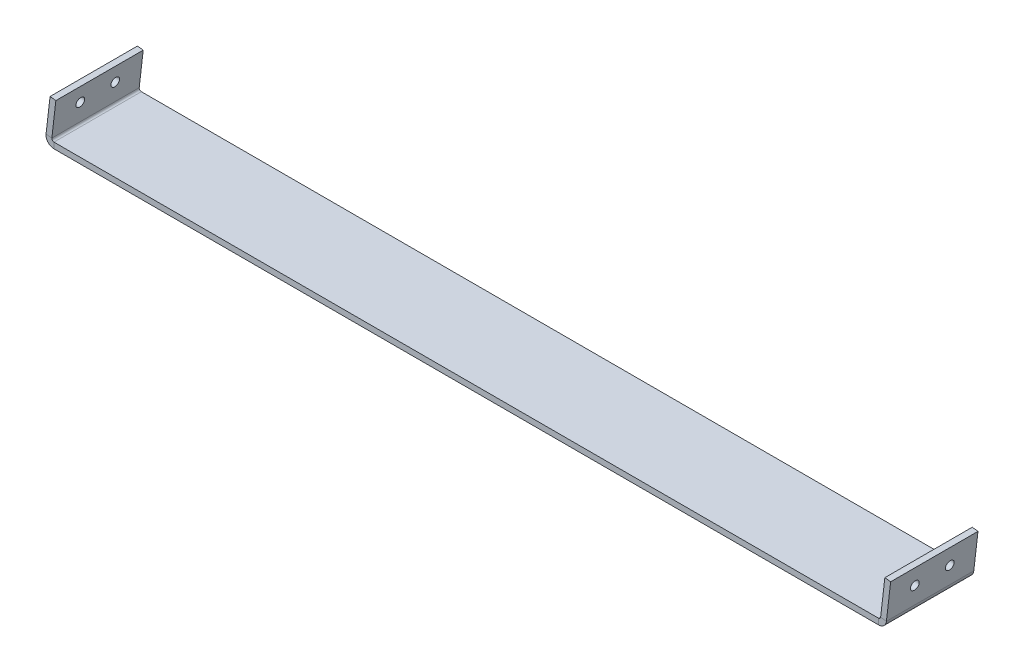
from build123d import *

# Parameters (mm, degrees)
SKETCH1_W                    = 284.5815
SKETCH1_H                    = 30
BASE_FLANGE1_DEPTH           = 2
EDGE_FLANGE1_STRIP_CUT_DEPTH = 30
EDGE_FLANGE1_DEPTH           = 30
EDGE_FLANGE2_STRIP_CUT_DEPTH = 30
EDGE_FLANGE2_DEPTH           = 30
SKETCH10_R                   = 1.5
MOUNTING_HOLES_DEPTH         = 2
SKETCH11_R                   = 1.5
CUT_EXTRUDE2_DEPTH           = 2


# Sheet-metal steps are written as plain solids
with BuildPart() as part:
    # Sketch1 → Base-Flange1 (new body)
    with BuildSketch(Plane(origin=(0, 0, 0), x_dir=(1, 0, 0), z_dir=(0, 1, 0))):
        with Locations((142.29075, -15)):
            Rectangle(SKETCH1_W, SKETCH1_H)
    extrude(amount=-BASE_FLANGE1_DEPTH)

    # Edge-Flange1 strip (across the edge) → Edge-Flange1 strip cut (cut)
    with BuildSketch(Plane(origin=(0, 0, 0), x_dir=(0.9933652782994915, -0.1150018428938158, 0), z_dir=(0, 0, 1))):
        Polygon((-9.511321415, -3.11448322), (1.051314043, -1.891647502), (0.821310357, 0.095083054), (-9.741325101, -1.127752664), align=None)
    extrude(amount=EDGE_FLANGE1_STRIP_CUT_DEPTH, mode=Mode.SUBTRACT)

    # Edge-Flange1 section (across the edge) → Edge-Flange1 (add)
    with BuildSketch(Plane(origin=(0, 0, 0), x_dir=(0.9933652782994915, -0.1150018428938158, 0), z_dir=(0, 0, 1))):
        with BuildLine():
            Line((-2, 0.826795918), (-2, 12.755102041))
            Line((-2, 12.755102041), (0, 12.755102041))
            Line((0, 12.755102041), (0, 0.826795918))
            ThreePointArc((0, 0.826795918), (0.246609229, 0.276806278), (0.821310357, 0.095083054))
            Line((0.821310357, 0.095083054), (1.051314043, -1.891647502))
            ThreePointArc((1.051314043, -1.891647502), (-1.083802855, -1.216513409), (-2, 0.826795918))
        make_face()
    extrude(amount=EDGE_FLANGE1_DEPTH)

    # Edge-Flange2 strip (across the edge) → Edge-Flange2 strip cut (cut)
    with BuildSketch(Plane(origin=(284.5815, 0, 30), x_dir=(-0.9933652782994906, 0.11500184289382274, 0), z_dir=(0, 0, -1))):
        Polygon((-8.988461998, -0.972764326), (0.421885957, -2.062199784), (0.651889643, -0.075469228), (-8.758458312, 1.013966231), align=None)
    extrude(amount=EDGE_FLANGE2_STRIP_CUT_DEPTH, mode=Mode.SUBTRACT)

    # Edge-Flange2 section (across the edge) → Edge-Flange2 (add)
    with BuildSketch(Plane(origin=(284.5815, 0, 30), x_dir=(-0.9933652782994906, 0.11500184289382274, 0), z_dir=(0, 0, -1))):
        with BuildLine():
            Line((-2, 0.656243636), (-2, 13.218181818))
            Line((-2, 13.218181818), (0, 13.218181818))
            Line((0, 13.218181818), (0, 0.656243636))
            ThreePointArc((0, 0.656243636), (0.186610359, 0.166252866), (0.651889643, -0.075469228))
            Line((0.651889643, -0.075469228), (0.421885957, -2.062199784))
            ThreePointArc((0.421885957, -2.062199784), (-1.306709327, -1.164159219), (-2, 0.656243636))
        make_face()
    extrude(amount=EDGE_FLANGE2_DEPTH)

    # Sketch10 → Mounting Holes (cut)
    with BuildSketch(Plane(origin=(-1.986730557, 0.230003686, 0), x_dir=(0, 0, 1), z_dir=(-0.9933652782994914, 0.11500184289381583, 0))):
        with Locations(Location((9, 7.408352498, 0), (0, 0, 270))):
            Circle(SKETCH10_R)
        with Locations(Location((21, 7.408352498, 0), (0, 0, 270))):
            Circle(SKETCH10_R)
    extrude(amount=-MOUNTING_HOLES_DEPTH, mode=Mode.SUBTRACT)

    # Sketch11 → Cut-Extrude2 (cut)
    with BuildSketch(Plane(origin=(282.804519594, -32.740263469, 0), x_dir=(0, 0, -1), z_dir=(0.9933652782994908, -0.11500184289382205, 0))):
        with Locations(Location((-21, 39.945578772, 0), (0, 0, 90))):
            Circle(SKETCH11_R)
        with Locations(Location((-9, 39.945578772, 0), (0, 0, 90))):
            Circle(SKETCH11_R)
    extrude(amount=-CUT_EXTRUDE2_DEPTH, mode=Mode.SUBTRACT)


solid = part.part
